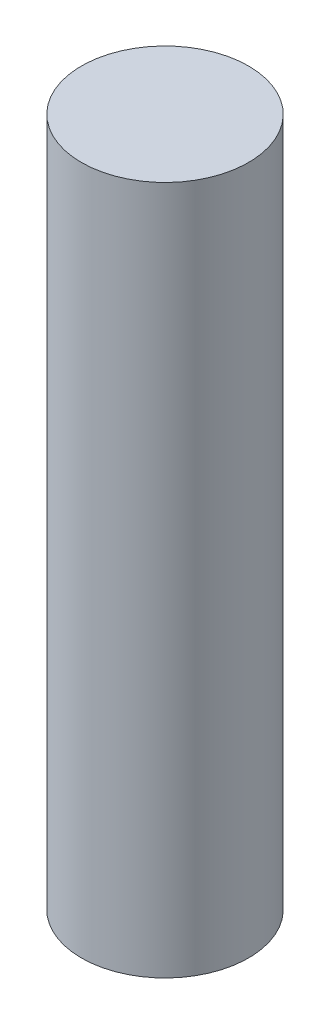
from build123d import *

# Parameters (mm, degrees)
SKETCH1_R           = 2.9
BOSS_EXTRUDE1_DEPTH = 23.9


with BuildPart() as part:
    # Sketch1 → Boss-Extrude1 (new body)
    with BuildSketch(Plane(origin=(0, 0, 0), x_dir=(1, 0, 0), z_dir=(0, 1, 0))):
        Circle(SKETCH1_R)
    extrude(amount=BOSS_EXTRUDE1_DEPTH)


solid = part.part
